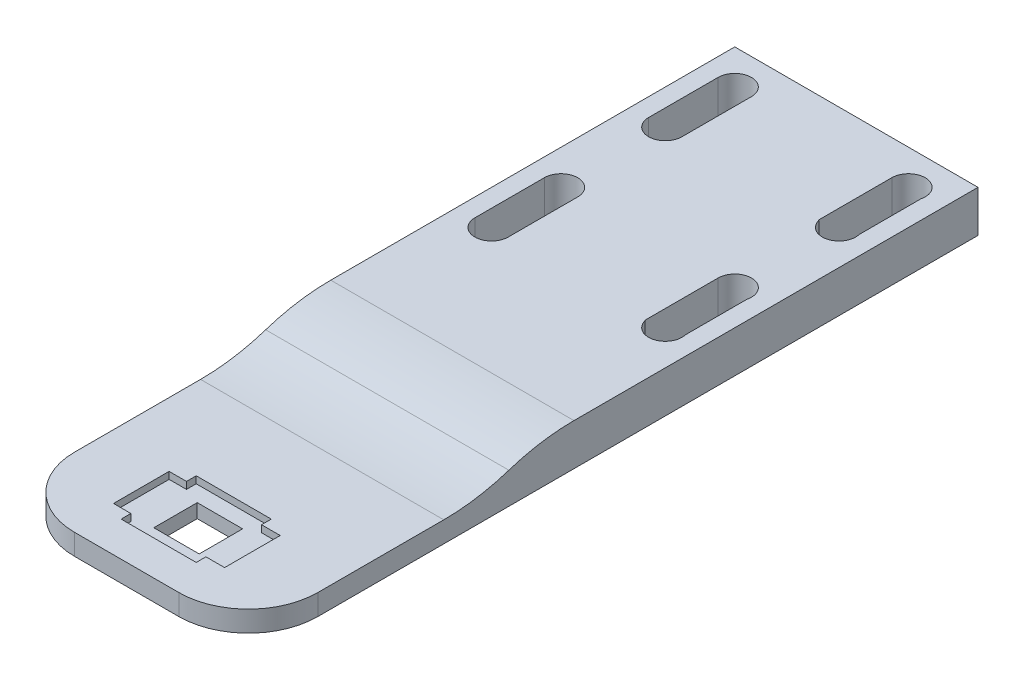
from build123d import *

# Parameters (mm, degrees)
SKETCH1_W            = 35
SKETCH1_H            = 105
BOSS_EXTRUDE1_DEPTH  = 6
M4_CLEARANCE_HOLE1_D = 4.8
LPATTERN2_COUNT      = 2
LPATTERN2_PITCH      = 10
SKETCH5_W            = 4.8
SKETCH5_H            = 10
SKETCH5_W_2          = 4.730666207
SKETCH5_H_2          = 10.572708501
CUT_EXTRUDE1_DEPTH   = 88.085432636
SKETCH6_W            = 10.8
SKETCH6_H            = 10.8
CUT_EXTRUDE2_DEPTH   = 4
SKETCH7_W            = 6.531210434
SKETCH7_H            = 6.251826861
CUT_EXTRUDE3_DEPTH   = 87.970527062
SKETCH8_W            = 15.98460087
SKETCH8_H            = 8
CUT_EXTRUDE4_DEPTH   = 4
FILLET1_R            = 10
CUT_EXTRUDE5_START   = -6
SKETCH9_W            = 37.049954943
SKETCH9_H            = 41.2
CUT_EXTRUDE5_DEPTH   = 3
FILLET2_R            = 30
FILLET3_R            = 30


with BuildPart() as part:
    # Sketch1 → Boss-Extrude1 (new body)
    with BuildSketch(Plane(origin=(0, 0, 0), x_dir=(1, 0, 0), z_dir=(0, 1, 0))):
        with Locations((0.111940299, -32.574626866)):
            Rectangle(SKETCH1_W, SKETCH1_H)
    extrude(amount=BOSS_EXTRUDE1_DEPTH)

    # M4 Clearance Hole1 (through all)
    with Locations(Plane(origin=(0, 6, 0), x_dir=(1, 0, 0), z_dir=(0, 1, 0))):
        with Locations((-12.388059701, 14.925373134), (12.611940299, 14.925373134), (12.611940299, -10.074626866), (-12.388059701, -10.074626866)):
            m4_clearance_hole1 = Hole(M4_CLEARANCE_HOLE1_D / 2)

    # LPattern2: M4 Clearance Hole1 ×2
    with Locations(*[(0, 0, i * LPATTERN2_PITCH) for i in range(1, LPATTERN2_COUNT)]):
        add(m4_clearance_hole1, mode=Mode.SUBTRACT)

    # Sketch5 → Cut-Extrude1 (cut, through all)
    with BuildSketch(Plane(origin=(0, 6, 0), x_dir=(1, 0, 0), z_dir=(0, 1, 0))):
        with Locations((-12.388059701, 9.925373134)):
            Rectangle(SKETCH5_W, SKETCH5_H)
        with Locations((-12.388059701, -15.074626866)):
            Rectangle(SKETCH5_W, SKETCH5_H)
        with Locations((12.577273403, 9.639018884)):
            Rectangle(SKETCH5_W_2, SKETCH5_H_2)
        with Locations((12.577273403, -15.360981116)):
            Rectangle(SKETCH5_W_2, SKETCH5_H_2)
    extrude(amount=-CUT_EXTRUDE1_DEPTH, mode=Mode.SUBTRACT)

    # Sketch6 → Cut-Extrude2 (cut)
    with BuildSketch(Plane(origin=(0, 6, 0), x_dir=(1, 0, 0), z_dir=(0, 1, 0))):
        with Locations((-0.288059701, -74.674626866)):
            Rectangle(SKETCH6_W, SKETCH6_H)
    extrude(amount=-CUT_EXTRUDE2_DEPTH, mode=Mode.SUBTRACT)

    # Sketch7 → Cut-Extrude3 (cut, through all)
    with BuildSketch(Plane(origin=(0, 2, 0), x_dir=(1, 0, 0), z_dir=(0, 1, 0))):
        with Locations((0, -74.674626866)):
            Rectangle(SKETCH7_W, SKETCH7_H)
    extrude(amount=-CUT_EXTRUDE3_DEPTH, mode=Mode.SUBTRACT)

    # Sketch8 → Cut-Extrude4 (cut)
    with BuildSketch(Plane(origin=(0, 6, 0), x_dir=(1, 0, 0), z_dir=(0, 1, 0))):
        with Locations((-0.195759266, -74.674626866)):
            Rectangle(SKETCH8_W, SKETCH8_H)
    extrude(amount=-CUT_EXTRUDE4_DEPTH, mode=Mode.SUBTRACT)

    # Fillet1
    fillet1_edges = [part.edges().sort_by_distance(p)[0] for p in [
        (17.611940299, 3, 85.074626866),
        (-17.388059701, 3, 85.074626866),
    ]]
    fillet(fillet1_edges, radius=FILLET1_R)

    # Sketch9 → Cut-Extrude5 (cut)
    with BuildSketch(Plane.XZ.offset(CUT_EXTRUDE5_START)):
        with Locations((1.136917771, 64.474626866)):
            Rectangle(SKETCH9_W, SKETCH9_H)
    extrude(amount=CUT_EXTRUDE5_DEPTH, mode=Mode.SUBTRACT)

    # Fillet2
    # the kernel refuses this fillet: 30 mm, written as the material it adds along each edge
    with BuildSketch(Plane(origin=(-17.388059701, 3, 43.874626866), x_dir=(0, 1, 0), z_dir=(1, 0, 0))) as fillet2_piece_1:
        with BuildLine():
            CenterArc((30, 13.076696831), FILLET2_R, 180, 25.841932763)
            Line((0, 13.076696831), (-0.6, 13.076696831))
            Line((-0.6, 13.076696831), (-0.6, 0))
            Line((-0.6, 0), (0, -0.6))
            ThreePointArc((0, -0.6), (1.5, -0.6), (2.46, -0.261533937))
            Line((2.46, -0.261533937), (3, 0))
        make_face()
    extrude(amount=35)

    # Fillet3
    fillet3_edges = [part.edges().sort_by_distance(p)[0] for p in [
        (0.111940299, 6, 43.874626866),
    ]]
    fillet(fillet3_edges, radius=FILLET3_R)


solid = part.part
